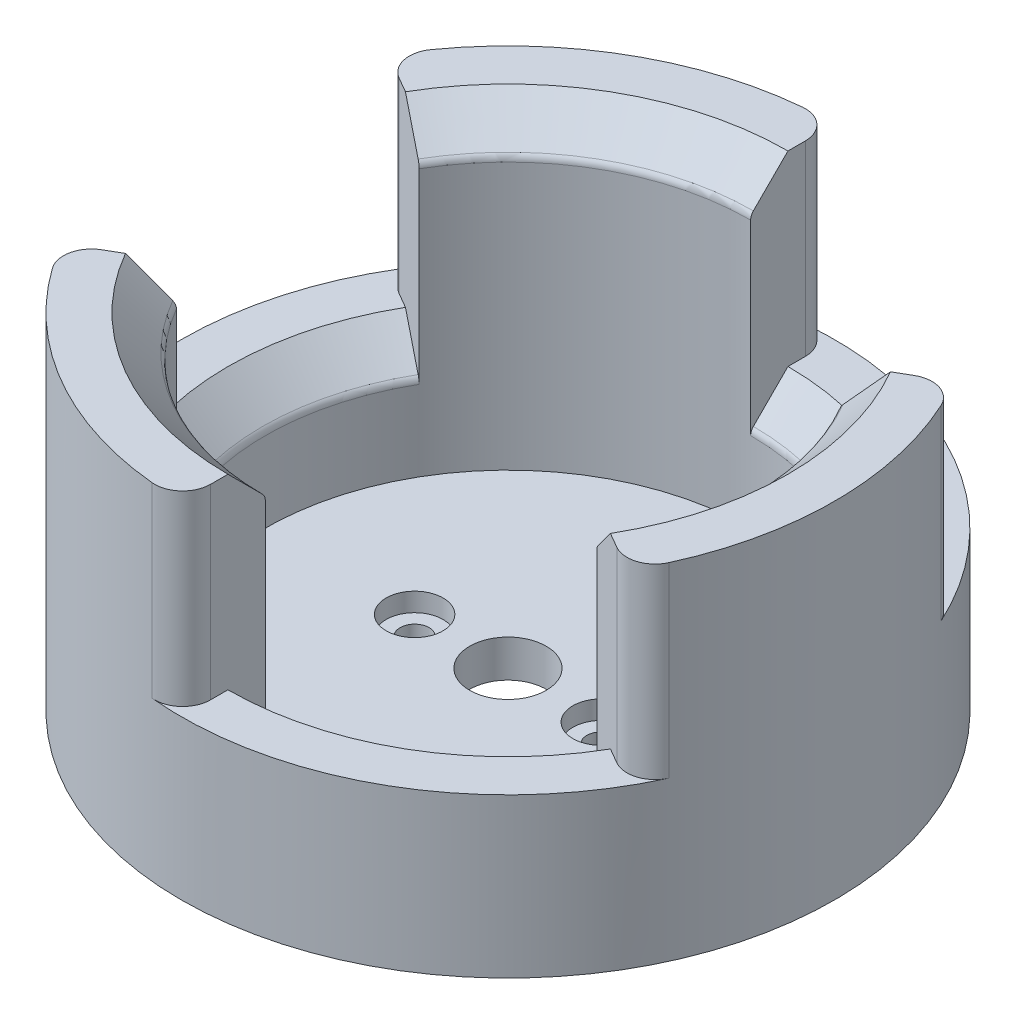
from build123d import *

# Parameters (mm, degrees)
SKETCH_1_R               = 35.00000000000001
SKETCH_1_R_2             = 26.000000000000007
EXTRUDE_1_DEPTH          = 33
EXTRUDE_START            = -4
SKETCH_1_5_R             = 35.00000000000001
EXTRUDE_2_DEPTH          = 4
CHAMFER_1_SIZE           = 4
FILLET_1_R               = 1
SKETCH_3_R               = 3.0500000000000043
SKETCH_3_R_2             = 3.0500000000000034
CUT_EXTRUDE_1_DEPTH      = 2
SKETCH_4_R               = 1.5499999999999994
CUT_EXTRUDE_3_DEPTH      = 7.500000000000001
SKETCH_6_R               = 4.1
CUT_EXTRUDE_4_DEPTH      = 5
CUT_EXTRUDE_START        = 13
CUT_EXTRUDE_5_DEPTH      = 47.489494926415375
PATTERN_CIRCULAR_2_COUNT = 3
CHAMFER_2_SIZE           = 4
FILLET_2_R               = 1
FILLET_3_R               = 3


with BuildPart() as part:
    # 草图1 → 凸台-拉伸1 (new body)
    with BuildSketch(Plane(origin=(0, 0, 0), x_dir=(1, 0, 0), z_dir=(0, 1, 0))):
        Circle(SKETCH_1_R)
        Circle(SKETCH_1_R_2, mode=Mode.SUBTRACT)
    extrude(amount=EXTRUDE_1_DEPTH)

    # 草图1<5> → 凸台-拉伸2 (add)
    with BuildSketch(Plane(origin=(0, 0, 0), x_dir=(1, 0, 0), z_dir=(0, 1, 0)).offset(EXTRUDE_START)):
        Circle(SKETCH_1_5_R)
    extrude(amount=EXTRUDE_2_DEPTH)

    # 倒角1
    chamfer_1_edges = [part.edges().sort_by_distance(p)[0] for p in [
        (-26.000000000000007, 33, -3.18e-15),
    ]]
    chamfer(chamfer_1_edges, length=CHAMFER_1_SIZE)

    # 圆角1
    fillet_1_edges = [part.edges().sort_by_distance(p)[0] for p in [
        (-26.000000000000007, 29, -3.18e-15),
    ]]
    fillet(fillet_1_edges, radius=FILLET_1_R)

    # 草图3 → 切除-拉伸1 (cut)
    with BuildSketch(Plane(origin=(0, 0, 0), x_dir=(1, 0, 0), z_dir=(0, 1, 0))):
        with Locations((10, 6.7e-16)):
            Circle(SKETCH_3_R)
        with Locations((-10, 0)):
            Circle(SKETCH_3_R_2)
    extrude(amount=-CUT_EXTRUDE_1_DEPTH, mode=Mode.SUBTRACT)

    # 草图4 → 切除-拉伸3 (cut)
    with BuildSketch(Plane(origin=(0, -2, 0), x_dir=(1, 0, 0), z_dir=(0, 1, 0))):
        with Locations((-10, 0)):
            Circle(SKETCH_4_R)
        with Locations((10, 0)):
            Circle(SKETCH_4_R)
    extrude(amount=-CUT_EXTRUDE_3_DEPTH, mode=Mode.SUBTRACT)

    # 草图6 → 切除-拉伸4 (cut)
    with BuildSketch(Plane(origin=(0, 0, 0), x_dir=(1, 0, 0), z_dir=(0, 1, 0))):
        Circle(SKETCH_6_R)
    extrude(amount=-CUT_EXTRUDE_4_DEPTH, mode=Mode.SUBTRACT)

    # 草图7 → 切除-拉伸5 (cut, through all)
    with BuildSketch(Plane(origin=(0, 0, 0), x_dir=(1, 0, 0), z_dir=(0, 1, 0)).offset(CUT_EXTRUDE_START)):
        with BuildLine():
            Line((0, 0), (-1.224e-13, -35.00000000000001))
            ThreePointArc((-1.224e-13, -35.00000000000001), (17.499999999999932, -30.3108891324554), (30.31088913245534, -17.50000000000004))
            Line((30.31088913245534, -17.50000000000004), (0, 0))
        make_face()
    cut_extrude_5 = extrude(amount=CUT_EXTRUDE_5_DEPTH, mode=Mode.SUBTRACT)

    # 阵列(圆周)2: 切除-拉伸5 ×3 about axis
    pattern_circular_2_axis = Axis((0, 33, 0), (0, -1, 0))
    for i in range(1, PATTERN_CIRCULAR_2_COUNT):
        add(cut_extrude_5.rotate(pattern_circular_2_axis, i * 360 / PATTERN_CIRCULAR_2_COUNT), mode=Mode.SUBTRACT)

    # 倒角2
    chamfer_2_edges = [part.edges().sort_by_distance(p)[0] for p in [
        (13.000000000000027, 13, -22.5166604983954),
        (12.999999999999952, 13, 22.516660498395442),
        (-26.000000000000007, 13, -4.3e-14),
    ]]
    chamfer(chamfer_2_edges, length=CHAMFER_2_SIZE)

    # 圆角2
    fillet_2_edges = [part.edges().sort_by_distance(p)[0] for p in [
        (12.99999999999995, 9, 22.516660498395442),
        (13.000000000000043, 9, -22.51666049839539),
        (-26.000000000000007, 9, -5.151e-14),
    ]]
    fillet(fillet_2_edges, radius=FILLET_2_R)

    # 圆角3
    fillet_3_edges = [part.edges().sort_by_distance(p)[0] for p in [
        (-30.310889132455372, 23, 17.49999999999998),
        (-1.224e-13, 23, 35.00000000000001),
        (30.310889132455344, 23, 17.500000000000036),
        (30.310889132455408, 23, -17.49999999999991),
        (-30.3108891324553, 23, -17.500000000000103),
        (1.599e-14, 23, -35.000000000000014),
    ]]
    fillet(fillet_3_edges, radius=FILLET_3_R)


solid = part.part
